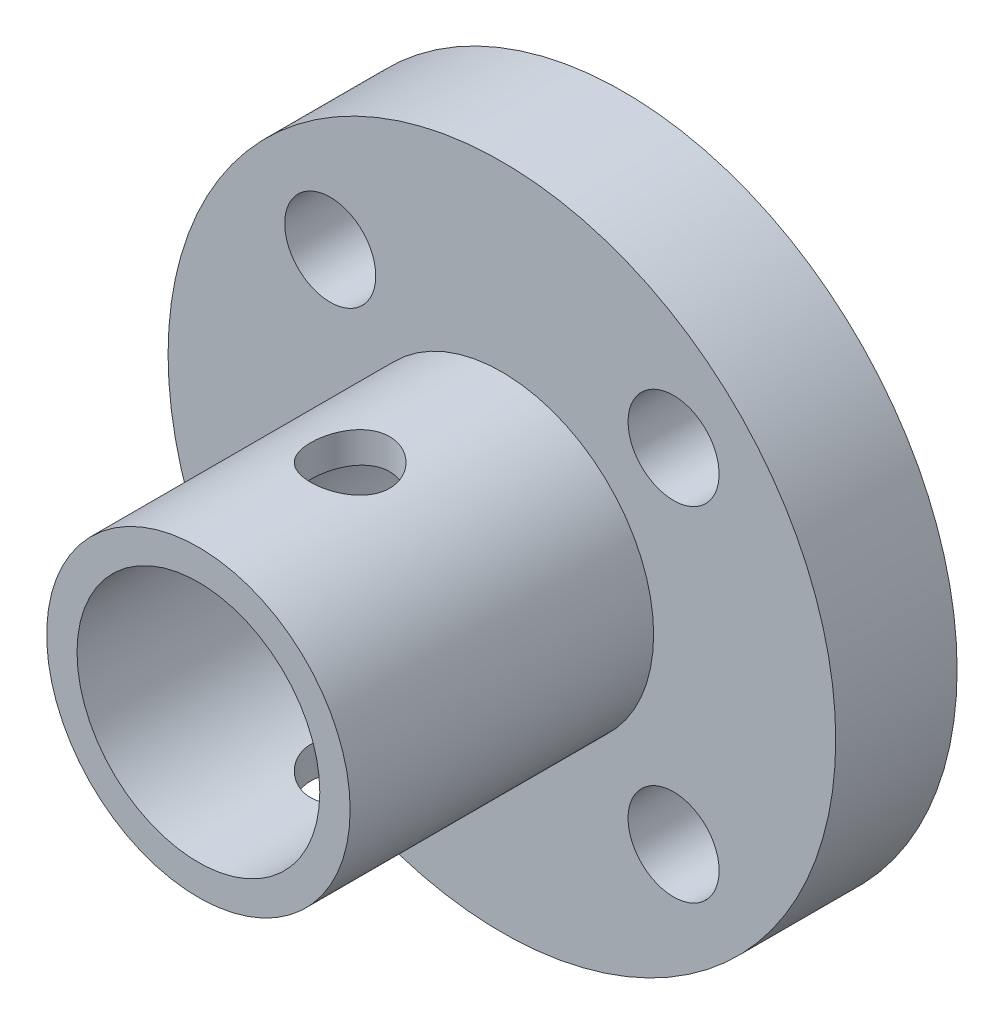
from build123d import *

# Parameters (mm, degrees)
SKETCH1_R               = 11
SKETCH1_R_2             = 4
SKETCH1_R_3             = 1.5
BOSS_EXTRUDE1_DEPTH     = 4
SKETCH2_R               = 5
SKETCH2_R_2             = 4
BOSS_EXTRUDE2_DEPTH     = 10
CUT_EXTRUDE1_DEPTH      = 21.928449536
CUT_EXTRUDE1_DEPTH_BACK = 21.928449536
SKETCH3_R               = 1.301925598


with BuildPart() as part:
    # Sketch1 → Boss-Extrude1 (new body)
    with BuildSketch(Plane.XY):
        Circle(SKETCH1_R)
        Circle(SKETCH1_R_2, mode=Mode.SUBTRACT)
        with Locations((-5.656854249, 5.656854249)):
            Circle(SKETCH1_R_3, mode=Mode.SUBTRACT)
        with Locations((5.656854249, 5.656854249)):
            Circle(SKETCH1_R_3, mode=Mode.SUBTRACT)
        with Locations((5.656854249, -5.656854249)):
            Circle(SKETCH1_R_3, mode=Mode.SUBTRACT)
        with Locations((-5.656854249, -5.656854249)):
            Circle(SKETCH1_R_3, mode=Mode.SUBTRACT)
    extrude(amount=BOSS_EXTRUDE1_DEPTH)

    # Sketch2 → Boss-Extrude2 (add)
    with BuildSketch(Plane.XY.offset(4)):
        Circle(SKETCH2_R)
        Circle(SKETCH2_R_2, mode=Mode.SUBTRACT)
    extrude(amount=BOSS_EXTRUDE2_DEPTH)

    # Sketch3 → Cut-Extrude1 (cut, two sides: drawn at the far end of the back side and taken through both)
    with BuildSketch(Plane(origin=(0, 0, 0), x_dir=(1, 0, 0), z_dir=(0, 1, 0)).offset(-CUT_EXTRUDE1_DEPTH_BACK)):
        with Locations((0, -9)):
            Circle(SKETCH3_R)
    extrude(amount=CUT_EXTRUDE1_DEPTH + CUT_EXTRUDE1_DEPTH_BACK, mode=Mode.SUBTRACT)


solid = part.part
